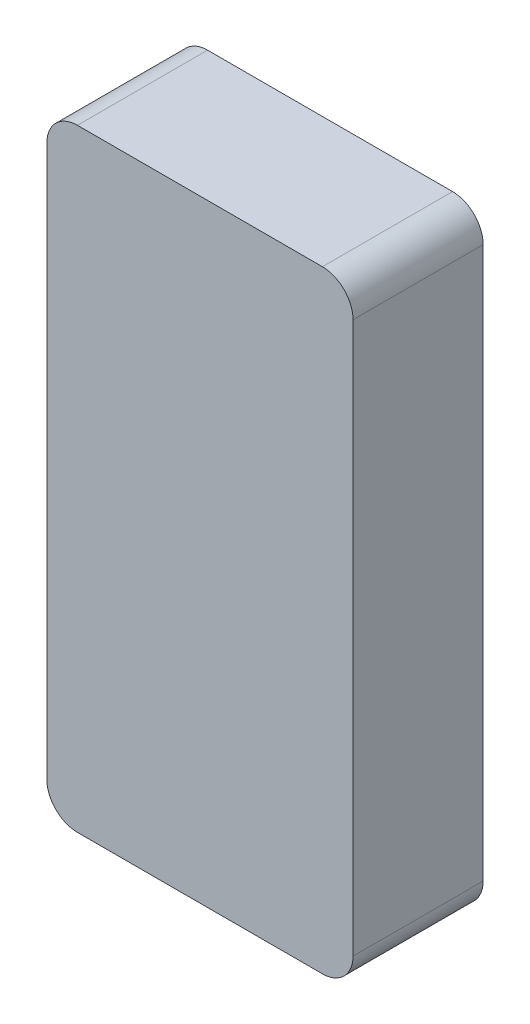
from build123d import *

# Parameters (mm, degrees)
SKETCH1_W           = 20
SKETCH1_H           = 40
BOSS_EXTRUDE1_DEPTH = 8.5
FILLET1_R           = 2


with BuildPart() as part:
    # Sketch1 → Boss-Extrude1 (new body)
    with BuildSketch(Plane.XY):
        Rectangle(SKETCH1_W, SKETCH1_H)
    extrude(amount=BOSS_EXTRUDE1_DEPTH)

    # Fillet1
    fillet1_edges = [part.edges().sort_by_distance(p)[0] for p in [
        (-10, -20, 4.25),
        (10, -20, 4.25),
        (-10, 20, 4.25),
        (10, 20, 4.25),
    ]]
    fillet(fillet1_edges, radius=FILLET1_R)


solid = part.part
